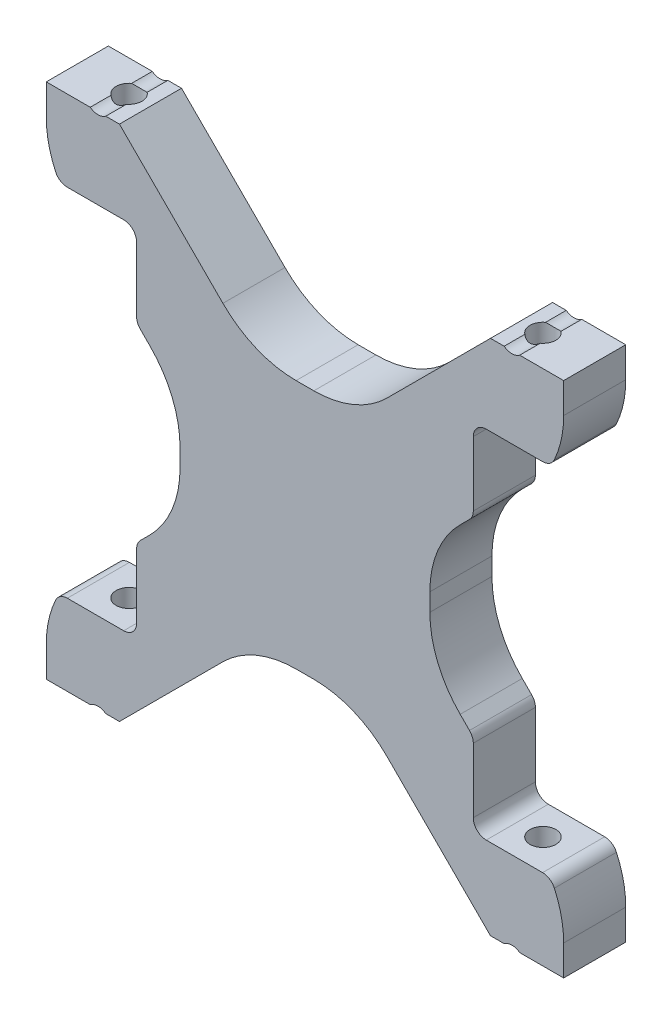
from build123d import *

# Parameters (mm, degrees)
EXTRUDE_1_DEPTH        = 6
CUT_EXTRUDE_1_DEPTH    = 42.104177289
FILLET_1_R             = 2
FILLET_1_OF_MIRROR_3_R = 2
SKETCH_3_R             = 1.25
CUT_EXTRUDE_2_DEPTH    = 59.233427122
SKETCH_4_W             = 4.242640687
SKETCH_4_H             = 50
CUT_EXTRUDE_3_DEPTH    = 39.937540168
FILLET_2_R             = 10
SKETCH_5_W             = 7.463630892
SKETCH_5_H             = 8
CUT_EXTRUDE_4_DEPTH    = 36.860842154
FILLET_3_R             = 1.25


with BuildPart() as part:
    # ｽｹｯﾁ1 → ﾎﾞｽ - 押し出し1 (new body)
    with BuildSketch(Plane.XY):
        Polygon((-32.071067812, 25), (-12.071067812, 5), (-12.071067812, -5), (-32.071067812, -25), (-17.928932188, -25), (-5, -12.071067812), (5, -12.071067812), (17.928932188, -25), (32.071067812, -25), (12.071067812, -5), (12.071067812, 5), (32.071067812, 25), (17.928932188, 25), (5, 12.071067812), (-5, 12.071067812), (-17.928932188, 25), align=None)
    extrude(amount=EXTRUDE_1_DEPTH)

    # ｽｹｯﾁ2 → ｶｯﾄ - 押し出し1 (cut, through all)
    with BuildSketch(Plane.XY.offset(6)):
        with BuildLine():
            Line((-20.75, 25), (-19.25, 25))
            ThreePointArc((-19.25, 25), (-20, 24.75), (-20.75, 25))
        make_face()
        with BuildLine():
            Line((20.75, 25), (19.25, 25))
            ThreePointArc((19.25, 25), (20, 24.75), (20.75, 25))
        make_face()
    cut_extrude_1 = extrude(amount=-CUT_EXTRUDE_1_DEPTH, mode=Mode.SUBTRACT)

    # ﾌｨﾚｯﾄ1
    fillet_1_edges = [part.edges().sort_by_distance(p)[0] for p in [
        (32.071067812, 25, 3),
        (-32.071067812, 25, 3),
    ]]
    fillet(fillet_1_edges, radius=FILLET_1_R)

    # ﾐﾗｰ3: ｶｯﾄ - 押し出し1 across plane
    add(cut_extrude_1.mirror(Plane.ZX), mode=Mode.SUBTRACT)

    # ﾌｨﾚｯﾄ1 of ﾐﾗｰ3
    fillet_1_of_mirror_3_edges = [part.edges().sort_by_distance(p)[0] for p in [
        (32.071067812, -25, 3),
        (-32.071067812, -25, 3),
    ]]
    fillet(fillet_1_of_mirror_3_edges, radius=FILLET_1_OF_MIRROR_3_R)

    # ｽｹｯﾁ3 → ｶｯﾄ - 押し出し2 (cut, through all)
    with BuildSketch(Plane(origin=(0, 25, 0), x_dir=(1, 0, 0), z_dir=(0, 1, 0))):
        with Locations((-20, -3)):
            Circle(SKETCH_3_R)
        with Locations((20, -3)):
            Circle(SKETCH_3_R)
    extrude(amount=-CUT_EXTRUDE_2_DEPTH, mode=Mode.SUBTRACT)

    # ｽｹｯﾁ4 → ｶｯﾄ - 押し出し3 (cut, through all)
    with BuildSketch(Plane.XY.offset(6)):
        with Locations((-27.121320344, 0)):
            Rectangle(SKETCH_4_W, SKETCH_4_H)
        with Locations((27.121320344, 0)):
            Rectangle(SKETCH_4_W, SKETCH_4_H)
    extrude(amount=-CUT_EXTRUDE_3_DEPTH, mode=Mode.SUBTRACT)

    # ﾌｨﾚｯﾄ2
    fillet_2_edges = [part.edges().sort_by_distance(p)[0] for p in [
        (25, 17.928932188, 3),
        (12.071067812, 5, 3),
        (12.071067812, -5, 3),
        (25, -17.928932188, 3),
        (5, -12.071067812, 3),
        (-5, -12.071067812, 3),
        (-25, -17.928932188, 3),
        (-12.071067812, -5, 3),
        (-12.071067812, 5, 3),
        (-25, 17.928932188, 3),
        (5, 12.071067812, 3),
        (-5, 12.071067812, 3),
    ]]
    fillet(fillet_2_edges, radius=FILLET_2_R)

    # ｽｹｯﾁ5 → ｶｯﾄ - 押し出し4 (cut, through all)
    with BuildSketch(Plane.XY.offset(6)):
        with Locations((-20, 13.197116743)):
            Rectangle(SKETCH_5_W, SKETCH_5_H)
        with Locations((20, 13.197116743)):
            Rectangle(SKETCH_5_W, SKETCH_5_H)
        with Locations((-20, -13.197116743)):
            Rectangle(SKETCH_5_W, SKETCH_5_H)
        with Locations((20, -13.197116743)):
            Rectangle(SKETCH_5_W, SKETCH_5_H)
    extrude(amount=-CUT_EXTRUDE_4_DEPTH, mode=Mode.SUBTRACT)

    # ﾌｨﾚｯﾄ3
    fillet_3_edges = [part.edges().sort_by_distance(p)[0] for p in [
        (-23.731815446, -17.197116743, 3),
        (-16.268184554, -17.197116743, 3),
        (-16.268184554, -9.197116743, 3),
        (23.731815446, -17.197116743, 3),
        (16.268184554, -9.197116743, 3),
        (16.268184554, -17.197116743, 3),
        (16.268184554, 9.197116743, 3),
        (23.731815446, 17.197116743, 3),
        (16.268184554, 17.197116743, 3),
        (-16.268184554, 9.197116743, 3),
        (-23.731815446, 17.197116743, 3),
        (-16.268184554, 17.197116743, 3),
    ]]
    fillet(fillet_3_edges, radius=FILLET_3_R)


solid = part.part
